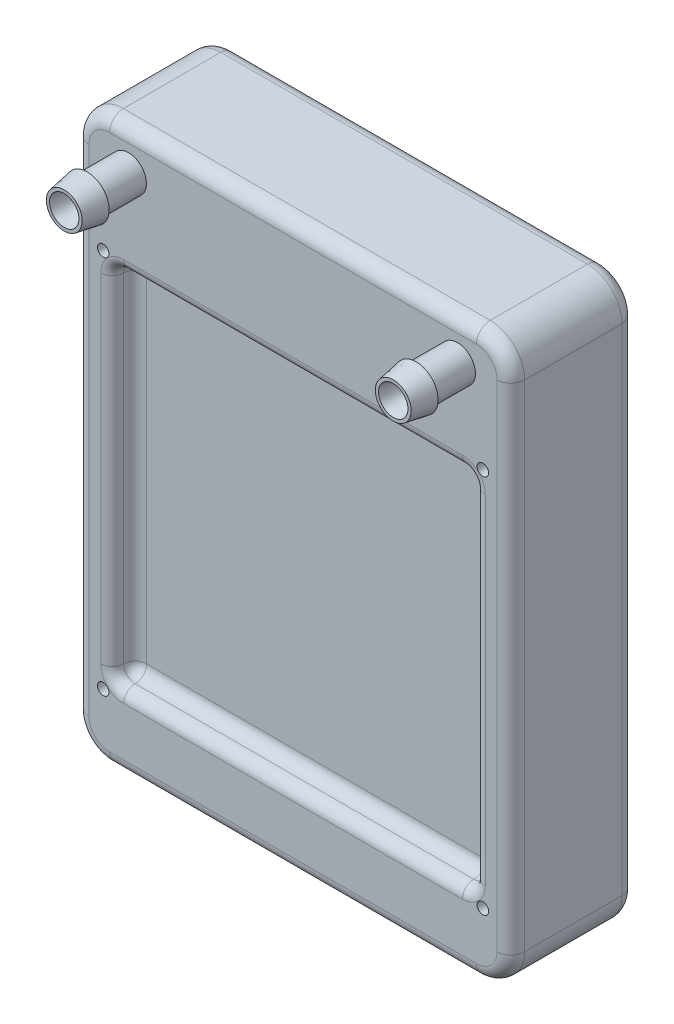
from build123d import *

# Parameters (mm, degrees)
SKETCH1_W                     = 120.5
SKETCH1_H                     = 156
SKETCH1_R                     = 1.5875
BOSS_EXTRUDE1_DEPTH           = 17.272
SKETCH2_R                     = 4.953
SKETCH2_R_2                   = 4.064
BOSS_EXTRUDE2_DEPTH           = 17.78
SKETCH3_R                     = 4.953
SKETCH3_R_2                   = 4.064
BOSS_EXTRUDE3_DEPTH           = 6.35
BOSS_EXTRUDE3_DRAFT           = 10
BOSS_EXTRUDE3_PROFILE_2_DEPTH = 6.35
BOSS_EXTRUDE3_PROFILE_2_DRAFT = 10
FILLET1_R                     = 3.81
FILLET2_R                     = 9.525
SKETCH4_W                     = 100
SKETCH4_H                     = 100
CUT_EXTRUDE1_DEPTH            = 6.35
FILLET3_R                     = 3.175
FILLET3_OF_MIRROR1_R          = 3.175


# Some blends are built 0.0001 mm under size
with BuildPart() as part:
    # Sketch1 → Boss-Extrude1 (new, symmetric)
    with BuildSketch(Plane.XY):
        Rectangle(SKETCH1_W, SKETCH1_H)
        with Locations((-52.5, 45)):
            Circle(SKETCH1_R, mode=Mode.SUBTRACT)
        with Locations((52.5, 45)):
            Circle(SKETCH1_R, mode=Mode.SUBTRACT)
        with Locations((52.5, -60)):
            Circle(SKETCH1_R, mode=Mode.SUBTRACT)
        with Locations((-52.5, -60)):
            Circle(SKETCH1_R, mode=Mode.SUBTRACT)
    extrude(amount=BOSS_EXTRUDE1_DEPTH, both=True)

    # Sketch2 → Boss-Extrude2 (add)
    # profile 1 of 2: a face of its own
    with BuildSketch(Plane.XY.offset(17.272)):
        with Locations((-45.5, 67)):
            Circle(SKETCH2_R)
        with Locations((-45.5, 67)):
            Circle(SKETCH2_R_2, mode=Mode.SUBTRACT)
    # profile 2 of 2: a face of its own
    with BuildSketch(Plane.XY.offset(17.272)):
        with Locations((45.5, 67)):
            Circle(SKETCH2_R)
        with Locations((45.5, 67)):
            Circle(SKETCH2_R_2, mode=Mode.SUBTRACT)
    extrude(amount=BOSS_EXTRUDE2_DEPTH)


with BuildPart() as boss_extrude3_tool:
    # Sketch3 → Boss-Extrude3 (with draft: the straight prism first)
    with BuildSketch(Plane.XY.offset(35.052)):
        with Locations((-45.5, 67)):
            Circle(SKETCH3_R)
        with Locations((-45.5, 67)):
            Circle(SKETCH3_R_2, mode=Mode.SUBTRACT)
    extrude(amount=-BOSS_EXTRUDE3_DEPTH)
    # Boss-Extrude3: the draft: its side faces are tilted about the plane it starts from
    boss_extrude3_sides = [boss_extrude3_tool.faces().sort_by_distance(p)[0] for p in [
        (-50.453, 67, 31.877),
        (-49.564, 67, 31.877),
    ]]
    draft(boss_extrude3_sides, Plane.XY.offset(35.052), BOSS_EXTRUDE3_DRAFT)


with BuildPart() as part_1:
    add(part.part)

    # Boss-Extrude3: add boss_extrude3_tool
    add(boss_extrude3_tool.part)


with BuildPart() as boss_extrude3_profile_2_tool:
    # Sketch3 → Boss-Extrude3 profile 2 (with draft: the straight prism first)
    with BuildSketch(Plane.XY.offset(35.052)):
        with Locations((45.5, 67)):
            Circle(SKETCH3_R)
        with Locations((45.5, 67)):
            Circle(SKETCH3_R_2, mode=Mode.SUBTRACT)
    extrude(amount=-BOSS_EXTRUDE3_PROFILE_2_DEPTH)
    # Boss-Extrude3 profile 2: the draft: its side faces are tilted about the plane it starts from
    boss_extrude3_profile_2_sides = [boss_extrude3_profile_2_tool.faces().sort_by_distance(p)[0] for p in [
        (40.547, 67, 31.877),
        (41.436, 67, 31.877),
    ]]
    draft(boss_extrude3_profile_2_sides, Plane.XY.offset(35.052), BOSS_EXTRUDE3_PROFILE_2_DRAFT)


with BuildPart() as part_2:
    add(part_1.part)

    # Boss-Extrude3 profile 2: add boss_extrude3_profile_2_tool
    add(boss_extrude3_profile_2_tool.part)

    # Fillet1
    fillet1_edges = [part_2.edges().sort_by_distance(p)[0] for p in [
        (-60.25, 0, 17.272),
        (0, -78, 17.272),
        (60.25, 0, 17.272),
        (0, -78, -17.272),
        (-60.25, 0, -17.272),
        (0, 78, -17.272),
        (60.25, 0, -17.272),
        (0, 78, 17.272),
    ]]
    fillet(fillet1_edges, radius=FILLET1_R)

    # Fillet2
    # the kernel refuses this fillet: 9.525 mm, written as the material it takes off along each edge
    with BuildSketch(Plane(origin=(-50.725, 68.475, 17.272), x_dir=(0, 1, 0), z_dir=(1, 0, 0))) as fillet2_piece_1:
        with BuildLine():
            CenterArc((5.715, -3.81), 3.81, 0, 90)
            Line((9.525, -3.81), (9.525, 0))
            Line((9.525, 0), (5.715, 0))
        make_face()
    revolve(axis=Axis((-50.725, 68.475, 17.272), (0, 0, 1)), revolution_arc=90, mode=Mode.SUBTRACT)
    with BuildSketch(Plane(origin=(50.725, 68.475, 17.272), x_dir=(1, 0, 0), z_dir=(0, -1, 0))) as fillet2_piece_2:
        with BuildLine():
            CenterArc((5.715, -3.81), 3.81, 0, 90)
            Line((9.525, -3.81), (9.525, 0))
            Line((9.525, 0), (5.715, 0))
        make_face()
    revolve(axis=Axis((50.725, 68.475, 17.272), (0, 0, 1)), revolution_arc=90, mode=Mode.SUBTRACT)
    with BuildSketch(Plane(origin=(-50.725, -68.475, 17.272), x_dir=(-1, 0, 0), z_dir=(0, 1, 0))) as fillet2_piece_3:
        with BuildLine():
            CenterArc((5.715, -3.81), 3.81, 0, 90)
            Line((9.525, -3.81), (9.525, 0))
            Line((9.525, 0), (5.715, 0))
        make_face()
    revolve(axis=Axis((-50.725, -68.475, 17.272), (0, 0, 1)), revolution_arc=90, mode=Mode.SUBTRACT)
    with BuildSketch(Plane(origin=(50.725, -68.475, 17.272), x_dir=(0, -1, 0), z_dir=(-1, 0, 0))) as fillet2_piece_4:
        with BuildLine():
            CenterArc((5.715, -3.81), 3.81, 0, 90)
            Line((9.525, -3.81), (9.525, 0))
            Line((9.525, 0), (5.715, 0))
        make_face()
    revolve(axis=Axis((50.725, -68.475, 17.272), (0, 0, 1)), revolution_arc=90, mode=Mode.SUBTRACT)
    with BuildSketch(Plane(origin=(-50.725, -68.475, -17.272), x_dir=(0, -1, 0), z_dir=(1, 0, 0))) as fillet2_piece_5:
        with BuildLine():
            CenterArc((5.715, -3.81), 3.81, 0, 90)
            Line((9.525, -3.81), (9.525, 0))
            Line((9.525, 0), (5.715, 0))
        make_face()
    revolve(axis=Axis((-50.725, -68.475, -17.272), (0, 0, -1)), revolution_arc=90, mode=Mode.SUBTRACT)
    with BuildSketch(Plane(origin=(-50.725, 68.475, -17.272), x_dir=(-1, 0, 0), z_dir=(0, -1, 0))) as fillet2_piece_6:
        with BuildLine():
            CenterArc((5.715, -3.81), 3.81, 0, 90)
            Line((9.525, -3.81), (9.525, 0))
            Line((9.525, 0), (5.715, 0))
        make_face()
    revolve(axis=Axis((-50.725, 68.475, -17.272), (0, 0, -1)), revolution_arc=90, mode=Mode.SUBTRACT)
    with BuildSketch(Plane(origin=(50.725, -68.475, -17.272), x_dir=(1, 0, 0), z_dir=(0, 1, 0))) as fillet2_piece_7:
        with BuildLine():
            CenterArc((5.715, -3.81), 3.81, 0, 90)
            Line((9.525, -3.81), (9.525, 0))
            Line((9.525, 0), (5.715, 0))
        make_face()
    revolve(axis=Axis((50.725, -68.475, -17.272), (0, 0, -1)), revolution_arc=90, mode=Mode.SUBTRACT)
    with BuildSketch(Plane(origin=(50.725, 68.475, -17.272), x_dir=(0, 1, 0), z_dir=(-1, 0, 0))) as fillet2_piece_8:
        with BuildLine():
            CenterArc((5.715, -3.81), 3.81, 0, 90)
            Line((9.525, -3.81), (9.525, 0))
            Line((9.525, 0), (5.715, 0))
        make_face()
    revolve(axis=Axis((50.725, 68.475, -17.272), (0, 0, -1)), revolution_arc=90, mode=Mode.SUBTRACT)
    with BuildSketch(Plane(origin=(60.25, -78, 17.272), x_dir=(0, 1, 0), z_dir=(0, 0, -1)), Plane(origin=(-60.25, -78, -17.272), x_dir=(0, 1, 0), z_dir=(0, 0, 1)), Plane(origin=(60.25, 78, 17.272), x_dir=(-1, 0, 0), z_dir=(0, 0, -1)), Plane(origin=(-60.25, 78, -17.272), x_dir=(1, 0, 0), z_dir=(0, 0, 1))) as fillet2_piece_9:
        with BuildLine():
            CenterArc((FILLET2_R, -FILLET2_R), FILLET2_R, 90, 90)
            Line((0, -FILLET2_R), (0, 0))
            Line((0, 0), (FILLET2_R, 0))
        make_face()
    extrude(amount=34.544, mode=Mode.SUBTRACT)

    # Sketch4 → Cut-Extrude1 (cut)
    with BuildSketch(Plane.XY.offset(17.272)):
        with Locations((0, -7.5)):
            Rectangle(SKETCH4_W, SKETCH4_H)
    cut_extrude1 = extrude(amount=-CUT_EXTRUDE1_DEPTH, mode=Mode.SUBTRACT)

    # Fillet3
    fillet3_edges = [part_2.edges().sort_by_distance(p)[0] for p in [
        (50, -7.5, 10.922),
        (50, 42.5, 14.097),
        (0, -57.5, 10.922),
        (50, -57.5, 14.097),
        (-50, -7.5, 10.922),
        (-50, -57.5, 14.097),
        (0, 42.5, 10.922),
        (-50, 42.5, 14.097),
        (50, -7.5, 17.272),
        (0, 42.5, 17.272),
        (-50, -7.5, 17.272),
        (0, -57.5, 17.272),
    ]]
    fillet(fillet3_edges, radius=FILLET3_R - 0.0001)  # a hair under: the kernel refuses the full size

    # Mirror1: Cut-Extrude1 across plane
    add(cut_extrude1.mirror(Plane.XY), mode=Mode.SUBTRACT)

    # Fillet3 of Mirror1
    fillet3_of_mirror1_edges = [part_2.edges().sort_by_distance(p)[0] for p in [
        (50, -7.5, -10.922),
        (50, 42.5, -14.097),
        (0, -57.5, -10.922),
        (50, -57.5, -14.097),
        (-50, -7.5, -10.922),
        (-50, -57.5, -14.097),
        (0, 42.5, -10.922),
        (-50, 42.5, -14.097),
        (50, -7.5, -17.272),
        (0, 42.5, -17.272),
        (-50, -7.5, -17.272),
        (0, -57.5, -17.272),
    ]]
    fillet(fillet3_of_mirror1_edges, radius=FILLET3_OF_MIRROR1_R - 0.0001)  # a hair under: the kernel refuses the full size


solid = part_2.part
